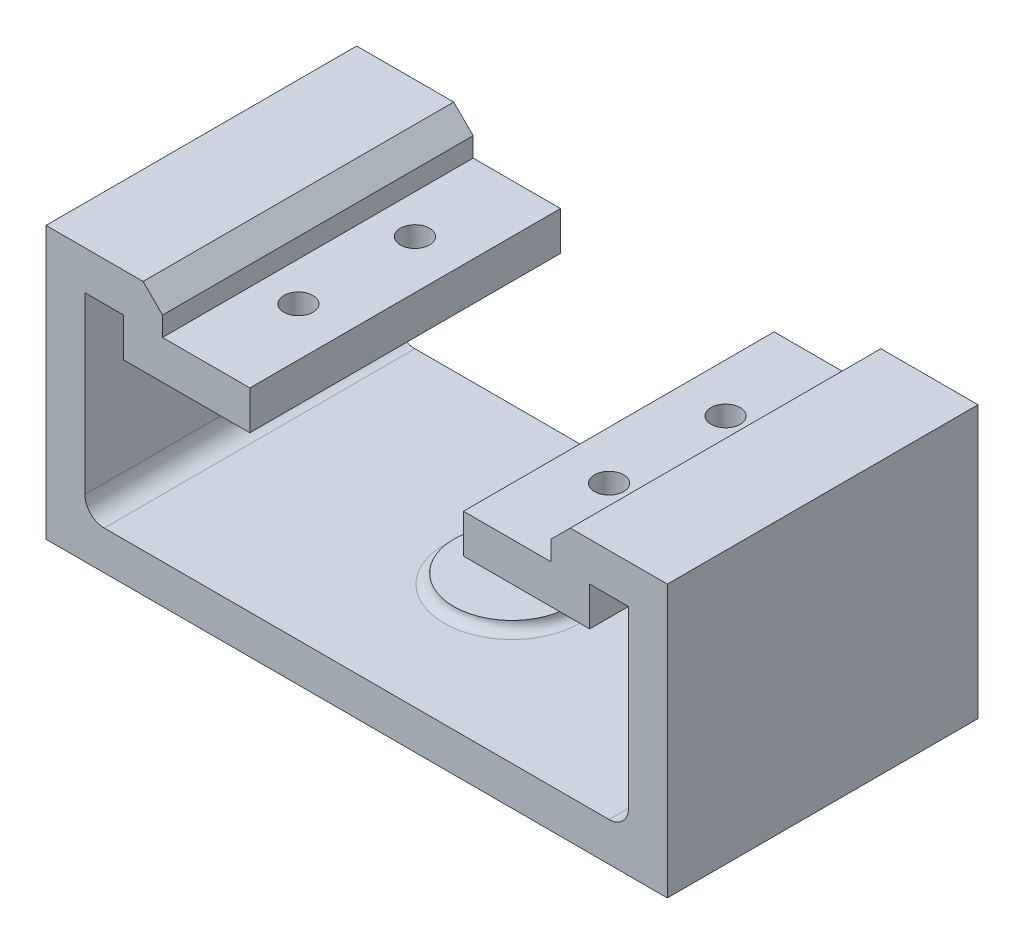
from build123d import *

# Parameters (mm, degrees)
BOSS_EXTRUDE1_DEPTH = 50.8
CUT_EXTRUDE1_REACH  = 138.783
SKETCH2_R           = 4.7625
SKETCH3_R           = 19.05
BOSS_EXTRUDE2_DEPTH = 3.175
FILLET1_R           = 6.35
FILLET2_R           = 3.175
CHAMFER1_SIZE       = 6.35


with BuildPart() as part:
    # Sketch1 → Boss-Extrude1 (new, symmetric)
    with BuildSketch(Plane.XY):
        Polygon((34.925, 76.2), (63.5, 76.2), (63.5, 88.9), (101.6, 88.9), (101.6, 0), (-101.6, 0), (-101.6, 88.9), (-63.5, 88.9), (-63.5, 76.2), (-34.925, 76.2), (-34.925, 63.5), (-76.2, 63.5), (-76.2, 76.2), (-88.9, 76.2), (-88.9, 12.7), (88.9, 12.7), (88.9, 76.2), (76.2, 76.2), (76.2, 63.5), (34.925, 63.5), align=None)
    extrude(amount=BOSS_EXTRUDE1_DEPTH, both=True)

    # Sketch2 → Cut-Extrude1 (cut, up to next)
    with BuildSketch(Plane(origin=(0, 76.2, 0), x_dir=(1, 0, 0), z_dir=(0, 1, 0)), mode=Mode.PRIVATE) as cut_extrude1_sk1:
        with Locations(Location((-50.8, 19.05, 0), (0, 0, 270))):
            Circle(SKETCH2_R)
    cut_extrude1_tool1 = extrude(cut_extrude1_sk1.sketch, amount=-CUT_EXTRUDE1_REACH, mode=Mode.PRIVATE) & part.part
    # Sketch2 → Cut-Extrude1 (cut, up to next)
    with BuildSketch(Plane(origin=(0, 76.2, 0), x_dir=(1, 0, 0), z_dir=(0, 1, 0)), mode=Mode.PRIVATE) as cut_extrude1_sk2:
        with Locations(Location((-50.8, -19.05, 0), (0, 0, 270))):
            Circle(SKETCH2_R)
    cut_extrude1_tool2 = extrude(cut_extrude1_sk2.sketch, amount=-CUT_EXTRUDE1_REACH, mode=Mode.PRIVATE) & part.part
    # Sketch2 → Cut-Extrude1 (cut, up to next)
    with BuildSketch(Plane(origin=(0, 76.2, 0), x_dir=(1, 0, 0), z_dir=(0, 1, 0)), mode=Mode.PRIVATE) as cut_extrude1_sk3:
        with Locations(Location((50.8, 19.05, 0), (0, 0, 270))):
            Circle(SKETCH2_R)
    cut_extrude1_tool3 = extrude(cut_extrude1_sk3.sketch, amount=-CUT_EXTRUDE1_REACH, mode=Mode.PRIVATE) & part.part
    # Sketch2 → Cut-Extrude1 (cut, up to next)
    with BuildSketch(Plane(origin=(0, 76.2, 0), x_dir=(1, 0, 0), z_dir=(0, 1, 0)), mode=Mode.PRIVATE) as cut_extrude1_sk4:
        with Locations(Location((50.8, -19.05, 0), (0, 0, 270))):
            Circle(SKETCH2_R)
    cut_extrude1_tool4 = extrude(cut_extrude1_sk4.sketch, amount=-CUT_EXTRUDE1_REACH, mode=Mode.PRIVATE) & part.part
    add(cut_extrude1_tool1.solids().sort_by_distance((-50.8, 76.2, -19.05))[0], mode=Mode.SUBTRACT)
    add(cut_extrude1_tool2.solids().sort_by_distance((-50.8, 76.2, 19.05))[0], mode=Mode.SUBTRACT)
    add(cut_extrude1_tool3.solids().sort_by_distance((50.8, 76.2, -19.05))[0], mode=Mode.SUBTRACT)
    add(cut_extrude1_tool4.solids().sort_by_distance((50.8, 76.2, 19.05))[0], mode=Mode.SUBTRACT)

    # Sketch3 → Boss-Extrude2 (add, symmetric)
    with BuildSketch(Plane(origin=(0, 12.7, 0), x_dir=(1, 0, 0), z_dir=(0, 1, 0))):
        Circle(SKETCH3_R)
    extrude(amount=BOSS_EXTRUDE2_DEPTH, both=True)

    # Fillet1
    fillet1_edges = [part.edges().sort_by_distance(p)[0] for p in [
        (-88.9, 12.7, 0),
        (88.9, 12.7, 0),
    ]]
    fillet(fillet1_edges, radius=FILLET1_R)

    # Fillet2
    fillet2_edges = [part.edges().sort_by_distance(p)[0] for p in [
        (-19.05, 12.7, 0),
    ]]
    fillet(fillet2_edges, radius=FILLET2_R - 0.0001)  # a hair under: the kernel refuses the full size

    # Chamfer1
    chamfer1_edges = [part.edges().sort_by_distance(p)[0] for p in [
        (63.5, 88.9, 0),
        (-63.5, 88.9, 0),
    ]]
    chamfer(chamfer1_edges, length=CHAMFER1_SIZE)


solid = part.part
